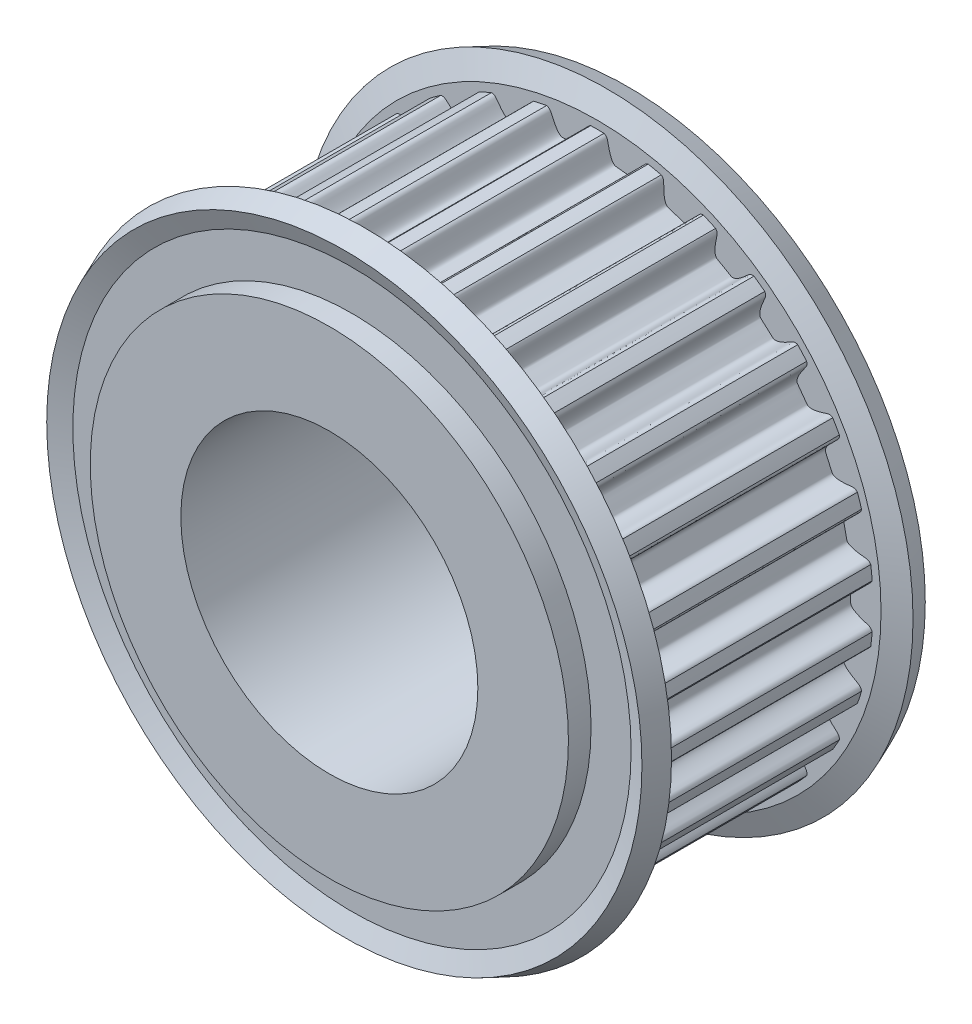
from build123d import *

# Parameters (mm, degrees)
TOOTHEXTRUDECUTGEARBELT01_DEPTH = 3.749999944
TOOTH_PATTERN_30_COUNT          = 30
BOREREVOLVESKETCH_W             = 10.547999842
BOREREVOLVESKETCH_H             = 5


with BuildPart() as part:
    # SketchRevolveGearBelt01 → Gates_PowerGrip_GT_2mm, 6mm Belt Width (revolve)
    with BuildSketch(Plane(origin=(0, 0, 0), x_dir=(0, 0, -1), z_dir=(1, 0, 0))):
        Polygon((5.273999921, 0), (5.273999921, 8.049296465), (4.511999932, 8.049296465), (4.511999932, 9.39772522), (4.769626867, 10.01969166), (4.065630673, 10.311296431), (3.749999944, 9.549296442), (3.749999944, 9.280480626), (-3.749999944, 9.280480626), (-3.749999944, 9.549296442), (-4.065630673, 10.311296431), (-4.769626867, 10.01969166), (-4.511999932, 9.39772522), (-4.511999932, 8.049296465), (-5.273999921, 8.049296465), (-5.273999921, 0), align=None)
    revolve(axis=Axis((0, 0, 0), (0, 0, -1)))

    # SketchToothGearBelt01 → ToothExtrudeCutGearBelt01 (cut, symmetric)
    with BuildSketch(Plane.XY):
        with BuildLine():
            ThreePointArc((9.259469869, 0.812097889), (9.295013999, 0), (9.259469869, -0.812097889))
            add(Edge.make_bspline(
                [(9.259469869, -0.812097889), (9.259882643, -0.798926426), (9.258535745, -0.779109129), (9.252881928, -0.753334284), (9.246755053, -0.734515852), (9.238801169, -0.716393821), (9.229098, -0.699145002), (9.217740163, -0.682937939), (9.204838756, -0.667930081), (9.190518793, -0.65427062), (9.174923394, -0.642082736), (9.158192233, -0.631523205), (9.140535394, -0.622553924), (9.096806178, -0.606636992), (9.040654354, -0.589254035), (8.974000339, -0.567478509), (8.923234955, -0.549822047), (8.875536871, -0.532182767), (8.830912224, -0.514541632), (8.789358436, -0.496903406), (8.750874778, -0.479266882), (8.715459684, -0.46163211), (8.68311132, -0.443998471), (8.653827322, -0.426364888), (8.627604868, -0.408729361), (8.604440496, -0.39108843), (8.584331378, -0.373436343), (8.567273563, -0.355764081), (8.553273739, -0.338058507), (8.542322401, -0.320303478), (8.534501566, -0.302483729), (8.529637264, -0.284599108), (8.527464323, -0.250294946), (8.531227193, -0.199977901), (8.531655597, -0.133284358), (8.532656984, -0.066646885), (8.532835685, 0), (8.532656984, 0.066646885), (8.531655597, 0.133284358), (8.531227193, 0.199977901), (8.527464323, 0.250294946), (8.529637264, 0.284599108), (8.534501566, 0.302483729), (8.542322401, 0.320303478), (8.553273739, 0.338058507), (8.567273563, 0.355764081), (8.584331378, 0.373436343), (8.604440496, 0.39108843), (8.627604868, 0.408729361), (8.653827322, 0.426364888), (8.68311132, 0.443998471), (8.715459684, 0.46163211), (8.750874778, 0.479266882), (8.789358436, 0.496903406), (8.830912224, 0.514541632), (8.875536871, 0.532182767), (8.923234955, 0.549822047), (8.974000339, 0.567478509), (9.040654354, 0.589254035), (9.096806178, 0.606636992), (9.140535394, 0.622553924), (9.158192233, 0.631523205), (9.174923394, 0.642082736), (9.190518793, 0.65427062), (9.204838756, 0.667930081), (9.217740163, 0.682937939), (9.229098, 0.699145002), (9.238801169, 0.716393821), (9.246755053, 0.734515852), (9.252881928, 0.753334284), (9.258535745, 0.779109129), (9.259882643, 0.798926426), (9.259469869, 0.812097889)],
                knots=[0, 0, 0, 0, 0.015923832, 0.023885748, 0.031847664, 0.039809581, 0.047771497, 0.055733413, 0.063695329, 0.071657245, 0.079619161, 0.087581077, 0.095542993, 0.10350491, 0.143783134, 0.166612007, 0.18826668, 0.208754844, 0.228085578, 0.246269698, 0.263320202, 0.279252862, 0.294087016, 0.307846634, 0.320561765, 0.332270503, 0.343021643, 0.352878214, 0.361921967, 0.370258601, 0.378022746, 0.385380527, 0.392526466, 0.419432991, 0.44628866, 0.47314433, 0.5, 0.52685567, 0.55371134, 0.580567009, 0.607473534, 0.614619473, 0.621977254, 0.629741399, 0.638078033, 0.647121786, 0.656978357, 0.667729497, 0.679438235, 0.692153366, 0.705912984, 0.720747138, 0.736679798, 0.753730302, 0.771914422, 0.791245156, 0.81173332, 0.833387993, 0.856216866, 0.89649509, 0.904457007, 0.912418923, 0.920380839, 0.928342755, 0.936304671, 0.944266587, 0.952228503, 0.960190419, 0.968152336, 0.976114252, 0.984076168, 1, 1, 1, 1], degree=3))
        make_face()
    toothextrudecutgearbelt01 = extrude(amount=TOOTHEXTRUDECUTGEARBELT01_DEPTH, both=True, mode=Mode.SUBTRACT)

    # Tooth Pattern, 30: ToothExtrudeCutGearBelt01 ×30 about axis
    tooth_pattern_30_axis = Axis((0, 0, 55), (0, 0, -1))
    for i in range(1, TOOTH_PATTERN_30_COUNT):
        add(toothextrudecutgearbelt01.rotate(tooth_pattern_30_axis, i * 360 / TOOTH_PATTERN_30_COUNT), mode=Mode.SUBTRACT)

    # BoreRevolveSketch → BoreRevolveCut (revolve, cut)
    with BuildSketch(Plane(origin=(0, 0, 0), x_dir=(0, 0, -1), z_dir=(1, 0, 0))):
        with Locations((0, 2.5)):
            Rectangle(BOREREVOLVESKETCH_W, BOREREVOLVESKETCH_H)
    revolve(axis=Axis((0, 0, 0), (0, 0, -1)), mode=Mode.SUBTRACT)


solid = part.part
